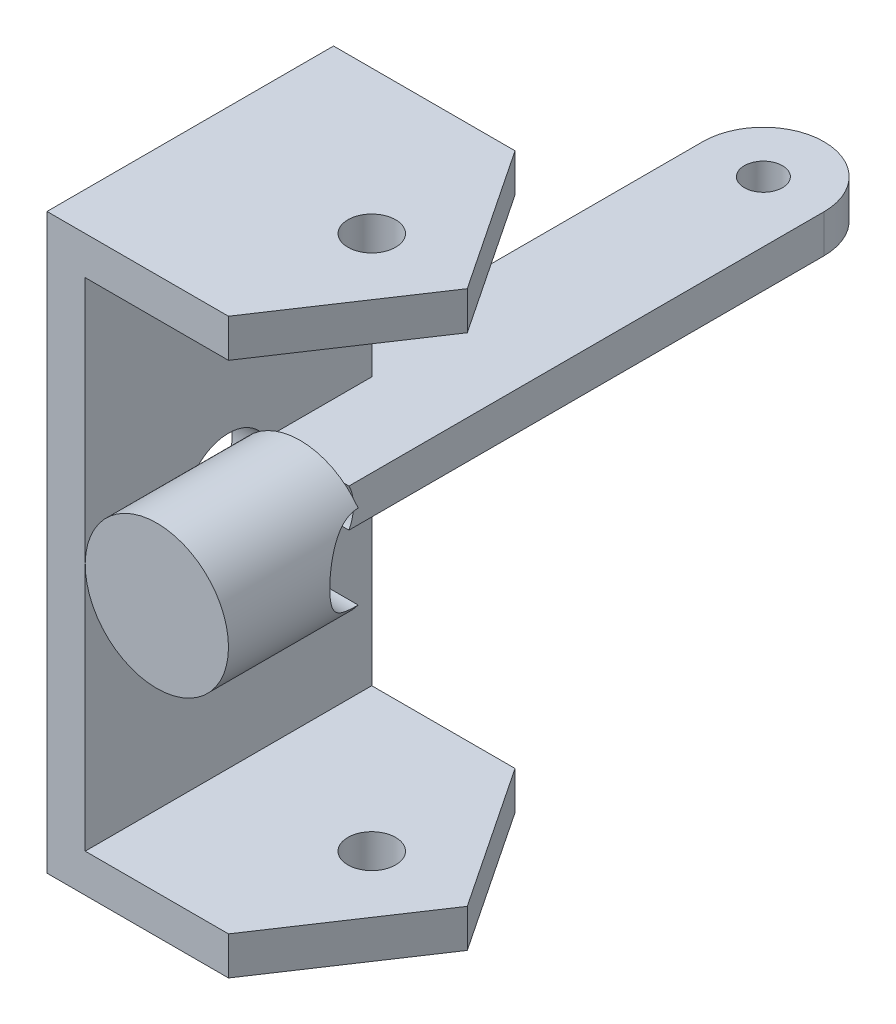
from build123d import *

# Parameters (mm, degrees)
SKETCH2_W               = 60
SKETCH2_H               = 120
BOSS_EXTRUDE1_DEPTH     = 8
SKETCH3_W               = 60
SKETCH3_H               = 8
BOSS_EXTRUDE2_DEPTH     = 50
CUT_EXTRUDE1_DEPTH      = 50
SKETCH5_R               = 5
CUT_EXTRUDE2_DEPTH      = 137.616250864
SKETCH7_W               = 25.4
SKETCH7_H               = 120
BOSS_EXTRUDE3_DEPTH     = 4
FILLET1_R               = 12.7
SKETCH9_R               = 4
CUT_EXTRUDE4_DEPTH      = 148.851276626
SKETCH11_R              = 15
BOSS_EXTRUDE4_DEPTH     = 30
CUT_EXTRUDE3_DEPTH      = 144.178210633
CUT_EXTRUDE3_DEPTH_BACK = 144.178210633
SKETCH6_R               = 8.790541624


with BuildPart() as part:
    # Sketch2 → Boss-Extrude1 (new body)
    with BuildSketch(Plane(origin=(0, 0, 0), x_dir=(0, 0, -1), z_dir=(1, 0, 0))):
        Rectangle(SKETCH2_W, SKETCH2_H)
    extrude(amount=BOSS_EXTRUDE1_DEPTH)

    # Sketch3 → Boss-Extrude2 (add)
    with BuildSketch(Plane(origin=(8, 0, 0), x_dir=(0, 0, -1), z_dir=(1, 0, 0))):
        with Locations((0, 56)):
            Rectangle(SKETCH3_W, SKETCH3_H)
    boss_extrude2 = extrude(amount=BOSS_EXTRUDE2_DEPTH)

    # Sketch4 → Cut-Extrude1 (cut)
    with BuildSketch(Plane(origin=(0, 60, 0), x_dir=(1, 0, 0), z_dir=(0, 1, 0))):
        Polygon((38, 30), (58, 0), (58, 30), align=None)
        Polygon((58, -30), (58, 0), (38, -30), align=None)
    cut_extrude1 = extrude(amount=-CUT_EXTRUDE1_DEPTH, mode=Mode.SUBTRACT)

    # Sketch5 → Cut-Extrude2 (cut, through all)
    with BuildSketch(Plane(origin=(0, 60, 0), x_dir=(1, 0, 0), z_dir=(0, 1, 0))):
        with Locations(Location((38, 0, 0), (0, 0, 270))):
            Circle(SKETCH5_R)
    cut_extrude2 = extrude(amount=-CUT_EXTRUDE2_DEPTH, mode=Mode.SUBTRACT)

    # Mirror1: Boss-Extrude2, Cut-Extrude1, Cut-Extrude2 across plane
    add(boss_extrude2.mirror(Plane.ZX))
    add(cut_extrude1.mirror(Plane.ZX), mode=Mode.SUBTRACT)
    add(cut_extrude2.mirror(Plane.ZX), mode=Mode.SUBTRACT)

    # Sketch7 → Boss-Extrude3 (add, symmetric)
    with BuildSketch(Plane(origin=(0, 0, 0), x_dir=(1, 0, 0), z_dir=(0, 1, 0))):
        with Locations((12.7, 60)):
            Rectangle(SKETCH7_W, SKETCH7_H)
    extrude(amount=BOSS_EXTRUDE3_DEPTH, both=True)

    # Fillet1
    fillet1_edges = [part.edges().sort_by_distance(p)[0] for p in [
        (0, 0, -120),
        (25.4, 0, -120),
    ]]
    fillet(fillet1_edges, radius=FILLET1_R - 0.0001)  # a hair under: the kernel refuses the full size

    # Sketch9 → Cut-Extrude4 (cut, through all)
    with BuildSketch(Plane(origin=(0, 4, 0), x_dir=(1, 0, 0), z_dir=(0, 1, 0))):
        with Locations(Location((12.7, 107.3, 0), (0, 0, 270))):
            Circle(SKETCH9_R)
    extrude(amount=-CUT_EXTRUDE4_DEPTH, mode=Mode.SUBTRACT)


with BuildPart() as body_2:
    # Sketch11 → Boss-Extrude4 (new body)
    with BuildSketch(Plane.XY):
        with Locations((23, 0)):
            Circle(SKETCH11_R)
    extrude(amount=BOSS_EXTRUDE4_DEPTH)


with BuildPart() as cut_extrude3_tool:
    # Sketch6 → Cut-Extrude3 (new, two sides: drawn at the far end of the back side and taken through both)
    with BuildSketch(Plane(origin=(8, 0, 0), x_dir=(0, 0, -1), z_dir=(1, 0, 0)).offset(-CUT_EXTRUDE3_DEPTH_BACK)):
        with Locations(Location((0, 0, 0), (0, 0, 27.067156143))):
            Circle(SKETCH6_R)
    extrude(amount=CUT_EXTRUDE3_DEPTH + CUT_EXTRUDE3_DEPTH_BACK)


with BuildPart() as part_1:
    add(part.part)

    # Cut-Extrude3: cut by cut_extrude3_tool
    add(cut_extrude3_tool.part, mode=Mode.SUBTRACT)


with BuildPart() as body_2_1:
    add(body_2.part)

    # Cut-Extrude3: cut by cut_extrude3_tool
    add(cut_extrude3_tool.part, mode=Mode.SUBTRACT)


solid = Compound([part_1.part, body_2_1.part])
